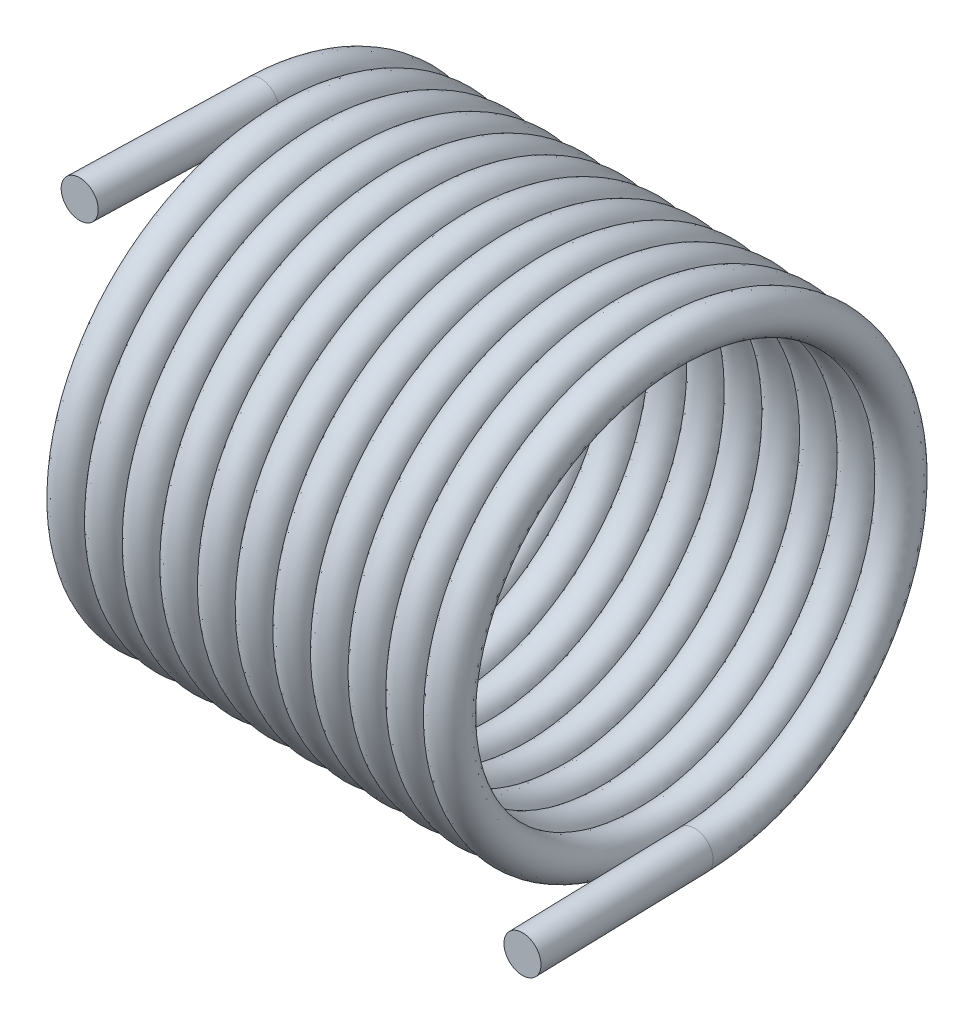
from build123d import *

# Parameters (mm, degrees)
SWEEP1_PITCH            = 1.6256
SKETCH3_R               = 0.8001
EXTRUDE1_DEPTH          = 50.8
SKETCH4_R               = 0.8001
EXTRUDE2_DEPTH          = 50.8
CUT_EXTRUDE1_DEPTH      = 56.861441024
CUT_EXTRUDE1_DEPTH_BACK = 56.861441024
SKETCH6_W               = 45.572309053
SKETCH6_H               = 1.6002
SKETCH6_W_2             = 46.651955562
SKETCH6_H_2             = 1.906662616


with BuildPart() as part:
    # Sweep1: the profile of Sketch2 screwed along a left-hand helix of 11.5 turns, 6 arcs to a turn; built about Z, then put on its axis
    sweep1_z = Axis((0, 0, 0), (0, 0, 1))
    sweep1_corners = [(9.840373704, 0.017174495, 0.619642512), (8.714619523, 0.014015807, 0.505679505), (8.828626296, -0.017174495, -0.619642512), (9.954380477, -0.014015807, -0.505679505)]
    with BuildLine(mode=Mode.PRIVATE) as sweep1_profile:
        ThreePointArc((9.840373704, 0.017174495, 0.619642512), (9.253885038, 0.022054874, 0.795722829), (8.714619523, 0.014015807, 0.505679505))
        ThreePointArc((8.714619523, 0.014015807, 0.505679505), (8.538471585, -0.002233529, -0.080584015), (8.828626296, -0.017174495, -0.619642512))
        ThreePointArc((8.828626296, -0.017174495, -0.619642512), (9.415114962, -0.022054874, -0.795722829), (9.954380477, -0.014015807, -0.505679505))
        ThreePointArc((9.954380477, -0.014015807, -0.505679505), (10.130528415, 0.002233529, 0.080584015), (9.840373704, 0.017174495, 0.619642512))
    sweep1_cap = Face(sweep1_profile.wire())
    sweep1_arcs = [((9.840373704, 0.017174495, 0.619642512), (9.220493227, 0.031190302, 1.125322017), (8.714619523, 0.014015807, 0.505679505), (1, 0.7071067811865476, 1)), ((8.714619523, 0.014015807, 0.505679505), (8.208745819, -0.003158687, -0.113963007), (8.828626296, -0.017174495, -0.619642512), (1, 0.7071067811865476, 1)), ((8.828626296, -0.017174495, -0.619642512), (9.448506773, -0.031190302, -1.125322017), (9.954380477, -0.014015807, -0.505679505), (1, 0.7071067811865476, 1)), ((9.954380477, -0.014015807, -0.505679505), (10.460254181, 0.003158687, 0.113963007), (9.840373704, 0.017174495, 0.619642512), (1, 0.7071067811865476, 1))]  # start, shoulder, end, weights
    sweep1_turn_angles = [0, -30, -60, -90, -120, -150, -180, -210, -240, -270, -300, -330, -360]
    sweep1_turn_weights = [1, 0.8660254037844387, 1, 0.8660254037844387, 1, 0.8660254037844387, 1, 0.8660254037844387, 1, 0.8660254037844387, 1, 0.8660254037844387, 1]
    sweep1_turn_sides = [Face.make_bezier_surface([[Vector(p[j][0], p[j][1], 0).rotate(sweep1_z, sweep1_turn_angles[2 * i + k]) / sweep1_turn_weights[2 * i + k] + Vector(0, 0, p[j][2] + -SWEEP1_PITCH * sweep1_turn_angles[2 * i + k] / 360) for k in range(3)] for j in range(3)], [[p[3][j] * sweep1_turn_weights[2 * i + k] for k in range(3)] for j in range(3)]) for p in sweep1_arcs for i in range(6)]
    sweep1_last_angles = [-3960, -3990, -4020, -4050, -4080, -4110, -4140]
    sweep1_last_weights = [1, 0.8660254037844387, 1, 0.8660254037844387, 1, 0.8660254037844347, 1]
    sweep1_last_sides = [Face.make_bezier_surface([[Vector(p[j][0], p[j][1], 0).rotate(sweep1_z, sweep1_last_angles[2 * i + k]) / sweep1_last_weights[2 * i + k] + Vector(0, 0, p[j][2] + -SWEEP1_PITCH * sweep1_last_angles[2 * i + k] / 360) for k in range(3)] for j in range(3)], [[p[3][j] * sweep1_last_weights[2 * i + k] for k in range(3)] for j in range(3)]) for p in sweep1_arcs for i in range(3)]
    sweep1 = Plane(origin=(0, 0, 0), x_dir=(0, 1, 0), z_dir=(1, 0, 0)) * Solid(Shell([*[p.moved(Location((0, 0, SWEEP1_PITCH * i))) for i in range(11) for p in sweep1_turn_sides], *sweep1_last_sides, sweep1_cap, sweep1_cap.rotate(sweep1_z, -4140).moved(Location((0, 0, -SWEEP1_PITCH * -4140 / 360)))]))
    add(sweep1)

    # Sketch3 → Extrude1 (add)
    with BuildSketch(Plane(origin=(0, 0, 0), x_dir=(-0.7744563325373843, -0.6322630972036725, -0.02146543517294771), z_dir=(-0.027706139045238477, -4.28129753871076e-15, 0.9996161112443147))):
        with Locations(Location((-5.901859881, -7.231938896, 0), (0, 0, 320.782712195))):
            Circle(SKETCH3_R)
    extrude(amount=EXTRUDE1_DEPTH)

    # Sketch4 → Extrude2 (add)
    with BuildSketch(Plane(origin=(0.014350385, 0, 0.517750811), x_dir=(0.8175772849996694, -0.5753728181346229, -0.0226606090913646), z_dir=(0.027706139045238463, 1.5980619605393542e-13, 0.9996161112443147))):
        with Locations(Location((20.654934368, 3.117514402, 0), (0, 0, 215.125745058))):
            Circle(SKETCH4_R)
    extrude(amount=EXTRUDE2_DEPTH)

    # Sketch6 → Cut-Extrude1 (cut, two sides: drawn at the far end of the back side and taken through both)
    with BuildSketch(Plane(origin=(0, 0, 0), x_dir=(0, 0, -1), z_dir=(1, 0, 0)).offset(-CUT_EXTRUDE1_DEPTH_BACK)):
        with Locations((-30.406154526, 9.3345)):
            Rectangle(SKETCH6_W, SKETCH6_H)
        with Locations((-30.945977781, -9.181268692)):
            Rectangle(SKETCH6_W_2, SKETCH6_H_2)
    extrude(amount=CUT_EXTRUDE1_DEPTH + CUT_EXTRUDE1_DEPTH_BACK, mode=Mode.SUBTRACT)


solid = part.part
